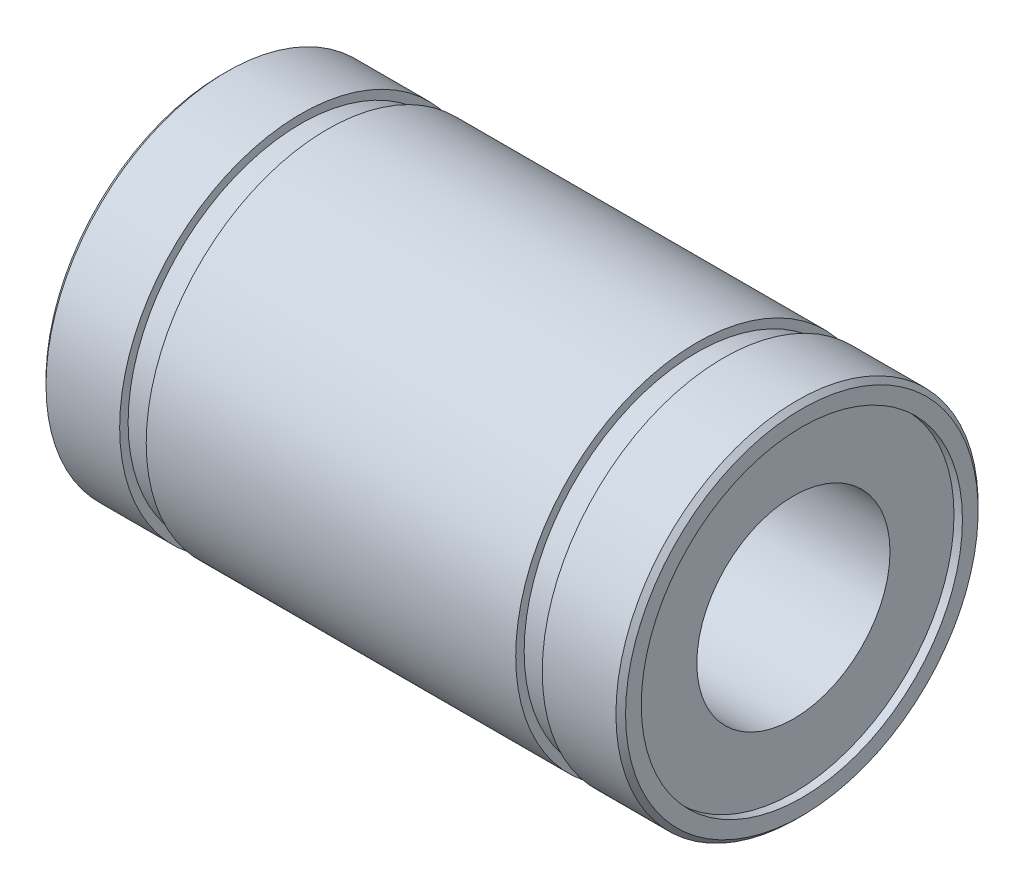
from build123d import *

# Parameters (mm, degrees)
CHAMFER1_SIZE = 0.2


with BuildPart() as part:
    # Sketch1 → Revolve1 (revolve)
    with BuildSketch(Plane.XY):
        Polygon((0.35, 4), (0.35, 6.65), (0, 6.65), (0, 7.5), (3.25, 7.5), (3.25, 7.15), (4.35, 7.15), (4.35, 7.5), (19.65, 7.5), (19.65, 7.15), (20.75, 7.15), (20.75, 7.5), (24, 7.5), (24, 6.65), (23.65, 6.65), (23.65, 4), align=None)
    revolve(axis=Axis((0, 0, 0), (1, 0, 0)))

    # Chamfer1
    chamfer1_edges = [part.edges().sort_by_distance(p)[0] for p in [
        (24, -7.5, 0),
        (0, -7.5, 0),
    ]]
    chamfer(chamfer1_edges, length=CHAMFER1_SIZE)


solid = part.part
